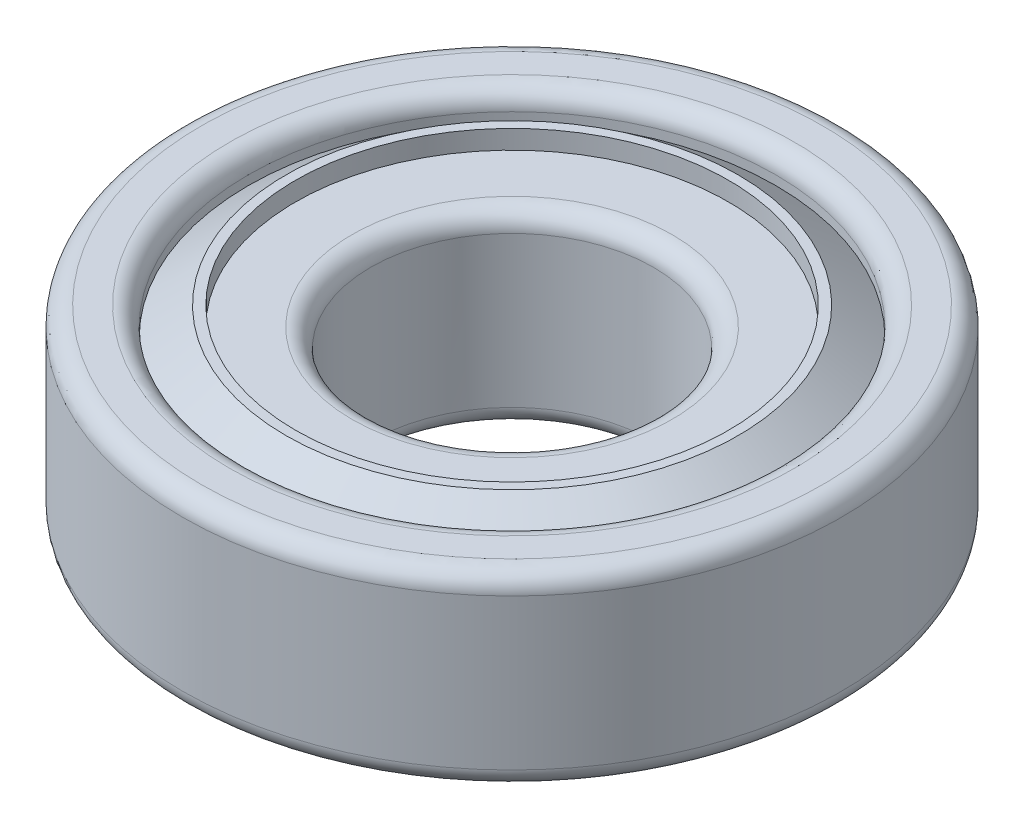
from build123d import *

# Parameters (mm, degrees)
CROQUIS1_W  = 4.75
CROQUIS1_H  = 1
REDONDEO1_R = 1
REDONDEO2_R = 1


with BuildPart() as part:
    # Croquis1 → Revolución1 (revolve)
    with BuildSketch(Plane.XY, mode=Mode.PRIVATE) as revoluci_n1_sk:
        Polygon((17.5, 10), (14, 10), (14, 8.504672962), (12, 10), (11.5, 10), (11.5, 9), (7.5, 9), (7.5, 0), (12.25, 0), (17.5, 0), align=None)
        with Locations((9.875, -0.5)):
            Rectangle(CROQUIS1_W, CROQUIS1_H)
    revolve(revoluci_n1_sk.sketch.rotate(Axis((0, 22.332999614, 0), (0, -1, 0)), 90), axis=Axis((0, 22.332999614, 0), (0, -1, 0)))

    # Redondeo1
    redondeo1_edges = [part.edges().sort_by_distance(p)[0] for p in [
        (0, 10, -17.5),
        (0, 0, -17.5),
    ]]
    fillet(redondeo1_edges, radius=REDONDEO1_R)

    # Redondeo2
    redondeo2_edges = [part.edges().sort_by_distance(p)[0] for p in [
        (0, 10, -14),
        (0, -1, -12.25),
        (0, -1, -7.5),
        (0, 9, -7.5),
    ]]
    fillet(redondeo2_edges, radius=REDONDEO2_R - 0.0001)  # a hair under: the kernel refuses the full size


solid = part.part
